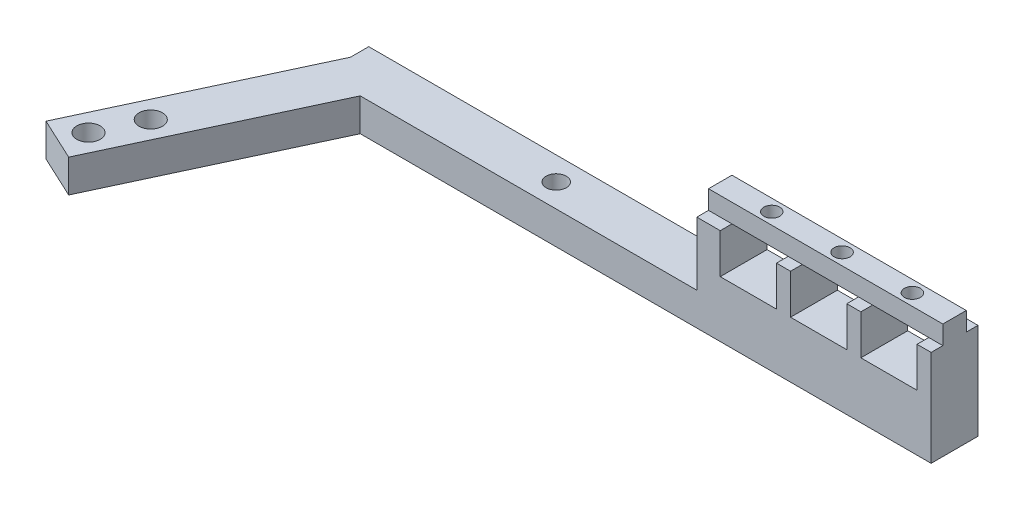
from build123d import *

# Parameters (mm, degrees)
SKETCH1_W           = 130
SKETCH1_H           = 10
SKETCH1_R           = 2.15
BOSS_EXTRUDE1_DEPTH = 7
SKETCH3_W           = 50
SKETCH3_H           = 10
BOSS_EXTRUDE2_DEPTH = 38.5
SKETCH9_W           = 10
SKETCH9_H           = 21
CUT_EXTRUDE5_DEPTH  = 139.095075944
SKETCH12_W          = 50
SKETCH12_H          = 4
CUT_EXTRUDE6_DEPTH  = 2.5
SKETCH13_W          = 50
SKETCH13_H          = 4
CUT_EXTRUDE7_DEPTH  = 2.5
SKETCH14_W          = 12
SKETCH14_H          = 8.5
CUT_EXTRUDE9_DEPTH  = 133.665933834
SKETCH15_R          = 1.7
CUT_EXTRUDE10_DEPTH = 132.98579469
BOSS_EXTRUDE4_DEPTH = 7
BOSS_EXTRUDE5_DEPTH = 7
SKETCH18_R          = 2.5
CUT_EXTRUDE11_DEPTH = 7
SKETCH19_R          = 2.5
CUT_EXTRUDE12_DEPTH = 7


with BuildPart() as part:
    # Sketch1 → Boss-Extrude1 (new body)
    with BuildSketch(Plane(origin=(0, 0, 0), x_dir=(1, 0, 0), z_dir=(0, 1, 0))):
        with Locations((65, -5)):
            Rectangle(SKETCH1_W, SKETCH1_H)
        with Locations((5, -5)):
            Circle(SKETCH1_R, mode=Mode.SUBTRACT)
        with Locations((45, -5)):
            Circle(SKETCH1_R, mode=Mode.SUBTRACT)
    extrude(amount=BOSS_EXTRUDE1_DEPTH)

    # Sketch3 → Boss-Extrude2 (add)
    with BuildSketch(Plane(origin=(0, 7, 0), x_dir=(1, 0, 0), z_dir=(0, 1, 0))):
        with Locations((105, -5)):
            Rectangle(SKETCH3_W, SKETCH3_H)
    extrude(amount=BOSS_EXTRUDE2_DEPTH)

    # Sketch9 → Cut-Extrude5 (cut, through all)
    with BuildSketch(Plane(origin=(130, 0, 0), x_dir=(0, 0, -1), z_dir=(1, 0, 0))):
        with Locations((-5, 35)):
            Rectangle(SKETCH9_W, SKETCH9_H)
    extrude(amount=-CUT_EXTRUDE5_DEPTH, mode=Mode.SUBTRACT)

    # Sketch12 → Cut-Extrude6 (cut)
    with BuildSketch(Plane.XY.offset(10)):
        with Locations((105, 22.5)):
            Rectangle(SKETCH12_W, SKETCH12_H)
    extrude(amount=-CUT_EXTRUDE6_DEPTH, mode=Mode.SUBTRACT)

    # Sketch13 → Cut-Extrude7 (cut)
    with BuildSketch(Plane(origin=(0, 0, 0), x_dir=(-1, 0, 0), z_dir=(0, 0, -1))):
        with Locations((-105, 22.5)):
            Rectangle(SKETCH13_W, SKETCH13_H)
    extrude(amount=-CUT_EXTRUDE7_DEPTH, mode=Mode.SUBTRACT)

    # Sketch14 → Cut-Extrude9 (cut, through all)
    with BuildSketch(Plane.XY.offset(10)):
        with Locations((121, 16.25)):
            Rectangle(SKETCH14_W, SKETCH14_H)
        with Locations((91, 16.25)):
            Rectangle(SKETCH14_W, SKETCH14_H)
        with Locations((106, 16.25)):
            Rectangle(SKETCH14_W, SKETCH14_H)
    extrude(amount=-CUT_EXTRUDE9_DEPTH, mode=Mode.SUBTRACT)

    # Sketch15 → Cut-Extrude10 (cut, through all)
    with BuildSketch(Plane(origin=(0, 20.5, 0), x_dir=(-1, 0, 0), z_dir=(0, -1, 0))):
        with Locations((-121, -5)):
            Circle(SKETCH15_R)
        with Locations((-106, -5)):
            Circle(SKETCH15_R)
        with Locations((-91, -5)):
            Circle(SKETCH15_R)
    extrude(amount=-CUT_EXTRUDE10_DEPTH, mode=Mode.SUBTRACT)

    # Sketch16 → Boss-Extrude4 (add)
    with BuildSketch(Plane(origin=(0, 0, 0), x_dir=(-1, 0, 0), z_dir=(0, -1, 0))):
        Polygon((-1.50258434, -7.646823985), (-0.468461065, -2.886908691), (-6.753211413, -1.521504853), (-7.787334687, -6.281420147), align=None)
        Polygon((0, -10), (-8.185351304, -10), (11.599374152, -52.428480661), (20.662452022, -48.202298043), (0, -3.891526687), align=None)
    extrude(amount=-BOSS_EXTRUDE4_DEPTH)

    # Sketch17 → Boss-Extrude5 (add)
    with BuildSketch(Plane.XZ):
        Polygon((2.4610909, 5.994926227), (7.864957682, 4.358157031), (8.790682018, 7.414477373), (3.386815236, 9.051246569), align=None)
    extrude(amount=-BOSS_EXTRUDE5_DEPTH)

    # Sketch18 → Cut-Extrude11 (cut)
    with BuildSketch(Plane(origin=(0, 0, 0), x_dir=(-1, 0, 0), z_dir=(0, -1, 0))):
        with Locations((14.017821778, -45.783850417)):
            Circle(SKETCH18_R)
    extrude(amount=-CUT_EXTRUDE11_DEPTH, mode=Mode.SUBTRACT)

    # Sketch19 → Cut-Extrude12 (cut)
    with BuildSketch(Plane(origin=(0, 0, 0), x_dir=(-1, 0, 0), z_dir=(0, -1, 0))):
        with Locations((9.791639161, -36.720772546)):
            Circle(SKETCH19_R)
    extrude(amount=-CUT_EXTRUDE12_DEPTH, mode=Mode.SUBTRACT)


solid = part.part
